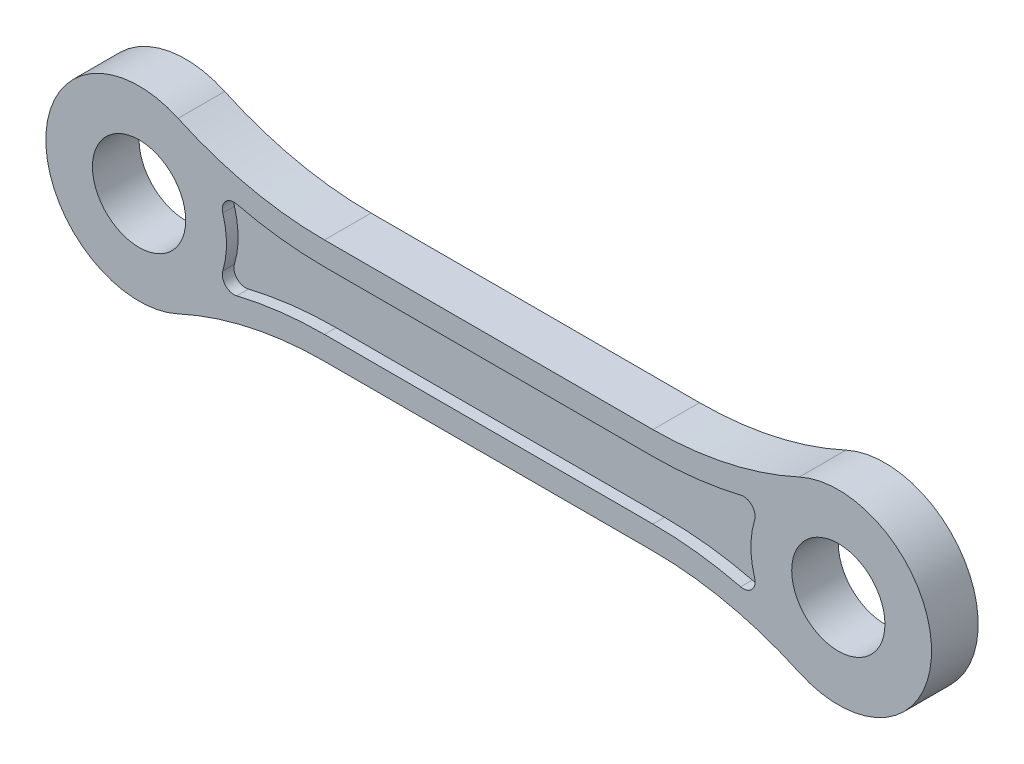
from build123d import *

# Parameters (mm, degrees)
SKETCH_1_R             = 4
EXTRUDE_1_DEPTH        = 4
CUT_EXTRUDE_START      = -10
CUT_EXTRUDE_1_DEPTH    = 10
CUT_EXTRUDE_2_DEPTH    = 1
FILLET_1_R             = 1
SKETCH_5_R             = 7.5
SKETCH_5_R_2           = 4
EXTRUDE_2_DEPTH        = 0.25
FILLET_1_OF_MIRROR_1_R = 1
SKETCH_4_R             = 7
SKETCH_4_R_2           = 5
CUT_EXTRUDE_3_DEPTH    = 1
FILLET_2_R             = 1
CUT_EXTRUDE_START_2    = -0.25
SKETCH_6_R             = 7.5
CUT_EXTRUDE_4_DEPTH    = 0.25


with BuildPart() as part:
    # 草图1 → 凸台-拉伸1 (new body)
    with BuildSketch(Plane.XY):
        with BuildLine():
            Line((-30, 8), (30, 8))
            ThreePointArc((30, 8), (38, 0), (30, -8))
            Line((30, -8), (-30, -8))
            ThreePointArc((-30, -8), (-38, 0), (-30, 8))
        make_face()
        with Locations((-30, 0)):
            Circle(SKETCH_1_R, mode=Mode.SUBTRACT)
        with Locations((30, 0)):
            Circle(SKETCH_1_R, mode=Mode.SUBTRACT)
    extrude(amount=EXTRUDE_1_DEPTH)

    # 草图2 → 切除-拉伸1 (cut)
    with BuildSketch(Plane.XY.offset(4).offset(CUT_EXTRUDE_START)):
        with BuildLine():
            Line((30, 8), (-30, 8))
            ThreePointArc((-30, 8), (-28.285581944, 7.814139155), (-26.650824686, 7.265192683))
            ThreePointArc((-26.650824686, 7.265192683), (-20.520484967, 5.206643412), (-14.091417259, 4.509665243))
            Line((-14.091417259, 4.509665243), (14.091417259, 4.509665243))
            ThreePointArc((14.091417259, 4.509665243), (20.520484967, 5.206643412), (26.650824686, 7.265192683))
            ThreePointArc((26.650824686, 7.265192683), (28.285581944, 7.814139155), (30, 8))
        make_face()
        with BuildLine():
            Line((14.091417259, -4.509665243), (-14.091417259, -4.509665243))
            ThreePointArc((-14.091417259, -4.509665243), (-20.520484967, -5.206643412), (-26.650824686, -7.265192683))
            ThreePointArc((-26.650824686, -7.265192683), (-28.285581944, -7.814139155), (-30, -8))
            Line((-30, -8), (30, -8))
            ThreePointArc((30, -8), (28.285581944, -7.814139155), (26.650824686, -7.265192683))
            ThreePointArc((26.650824686, -7.265192683), (20.520484967, -5.206643412), (14.091417259, -4.509665243))
        make_face()
    extrude(amount=CUT_EXTRUDE_1_DEPTH, mode=Mode.SUBTRACT)

    # 草图3 → 切除-拉伸2 (cut)
    with BuildSketch(Plane.XY.offset(4)):
        with BuildLine():
            ThreePointArc((-23.634199351, -3.965675491), (-18.918027247, -2.875761974), (-14.091417259, -2.509665243))
            Line((-14.091417259, -2.509665243), (14.091417259, -2.509665243))
            ThreePointArc((14.091417259, -2.509665243), (18.918027247, -2.875761974), (23.634199351, -3.965675491))
            ThreePointArc((23.634199351, -3.965675491), (22.5, 0), (23.634199351, 3.965675491))
            ThreePointArc((23.634199351, 3.965675491), (18.918027247, 2.875761974), (14.091417259, 2.509665243))
            Line((14.091417259, 2.509665243), (-14.091417259, 2.509665243))
            ThreePointArc((-14.091417259, 2.509665243), (-18.918027247, 2.875761974), (-23.634199351, 3.965675491))
            ThreePointArc((-23.634199351, 3.965675491), (-22.789122631, 2.062340313), (-22.5, 0))
            ThreePointArc((-22.5, 0), (-22.789122631, -2.062340313), (-23.634199351, -3.965675491))
        make_face()
    cut_extrude_2 = extrude(amount=-CUT_EXTRUDE_2_DEPTH, mode=Mode.SUBTRACT)

    # 圆角1
    fillet_1_edges = [part.edges().sort_by_distance(p)[0] for p in [
        (23.634199351, -3.965675491, 3.5),
        (-23.634199351, -3.965675491, 3.5),
        (-23.634199351, 3.965675491, 3.5),
        (23.634199351, 3.965675491, 3.5),
    ]]
    fillet(fillet_1_edges, radius=FILLET_1_R)

    # 草图5 → 凸台-拉伸2 (add)
    # profile 1 of 2: a face of its own
    with BuildSketch(Plane(origin=(0, 0, 0), x_dir=(-1, 0, 0), z_dir=(0, 0, -1))):
        with Locations((30, 0)):
            Circle(SKETCH_5_R)
        with Locations((30, 0)):
            Circle(SKETCH_5_R_2, mode=Mode.SUBTRACT)
    # profile 2 of 2: a face of its own
    with BuildSketch(Plane(origin=(0, 0, 0), x_dir=(-1, 0, 0), z_dir=(0, 0, -1))):
        with Locations(Location((-30, 0, 0), (0, 0, 180))):
            Circle(SKETCH_5_R)
        with Locations((-30, 0)):
            Circle(SKETCH_5_R_2, mode=Mode.SUBTRACT)
    extrude(amount=EXTRUDE_2_DEPTH)

    # 镜向1: 切除-拉伸2 across plane
    add(cut_extrude_2.mirror(Plane(origin=(0, 0, 2), x_dir=(1, 0, 0), z_dir=(0, 0, -1))), mode=Mode.SUBTRACT)

    # 圆角1 of 镜向1
    fillet_1_of_mirror_1_edges = [part.edges().sort_by_distance(p)[0] for p in [
        (23.634199351, -3.965675491, 0.5),
        (-23.634199351, -3.965675491, 0.5),
        (-23.634199351, 3.965675491, 0.5),
        (23.634199351, 3.965675491, 0.5),
    ]]
    fillet(fillet_1_of_mirror_1_edges, radius=FILLET_1_OF_MIRROR_1_R)

    # 草图4 → 切除-拉伸3 (cut)
    # profile 1 of 2: a face of its own
    with BuildSketch(Plane.XY.offset(-0.25)):
        with Locations((30, 0)):
            Circle(SKETCH_4_R)
        with Locations((30, 0)):
            Circle(SKETCH_4_R_2, mode=Mode.SUBTRACT)
    # profile 2 of 2: a face of its own
    with BuildSketch(Plane.XY.offset(-0.25)):
        with Locations((-30, 0)):
            Circle(SKETCH_4_R)
        with Locations((-30, 0)):
            Circle(SKETCH_4_R_2, mode=Mode.SUBTRACT)
    extrude(amount=CUT_EXTRUDE_3_DEPTH, mode=Mode.SUBTRACT)

    # 圆角2
    fillet_2_edges = [part.edges().sort_by_distance(p)[0] for p in [
        (23, 0, 0.75),
        (25, 0, 0.75),
        (-37, 0, 0.75),
        (-35, 0, 0.75),
    ]]
    fillet(fillet_2_edges, radius=FILLET_2_R - 0.0001)  # a hair under: the kernel refuses the full size

    # 草图6 → 切除-拉伸4 (cut)
    with BuildSketch(Plane(origin=(0, 0, -0.25), x_dir=(-1, 0, 0), z_dir=(0, 0, -1)).offset(CUT_EXTRUDE_START_2)):
        with Locations((30, 0)):
            Circle(SKETCH_6_R)
        with Locations((-30, 0)):
            Circle(SKETCH_6_R)
    extrude(amount=CUT_EXTRUDE_4_DEPTH, mode=Mode.SUBTRACT)


solid = part.part
